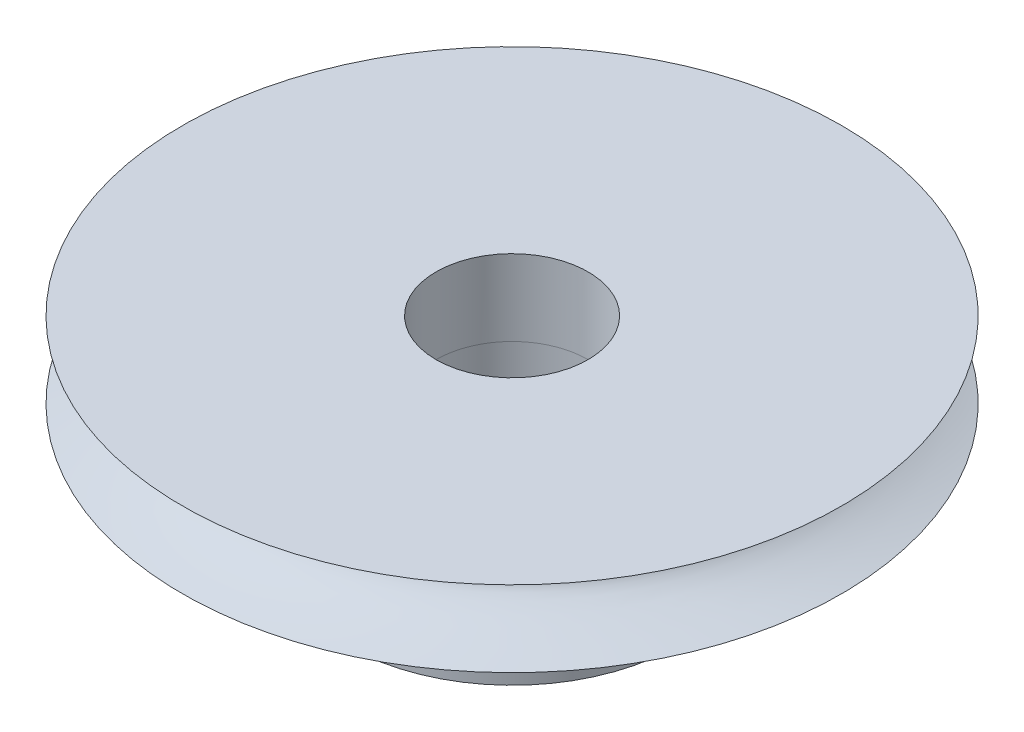
from build123d import *

# Parameters (mm, degrees)
SKETCH117_R           = 3
CUT_EXTRUDE4_DEPTH    = 3
SKETCH122_R           = 6.539767279
BOSS_EXTRUDE1_DEPTH   = 5
SKETCH123_R           = 3.0360463
CUT_EXTRUDE5_DEPTH    = 5
M2X0_4_TAPPED_HOLE1_D = 1.6


with BuildPart() as part:
    # Sketch9 → Revolve1 (revolve)
    with BuildSketch(Plane.XY):
        with BuildLine():
            Line((-4.703089141, -2.935363462), (8.296910859, -2.935363462))
            Line((8.296910859, -2.935363462), (8.296910859, 0.064636538))
            Line((8.296910859, 0.064636538), (-4.703089141, 0.064636538))
            add(Edge.make_bspline(
                [(-4.703089141, 0.064636538), (0.132127885, -1.294166307), (-4.703089141, -2.935363462)],
                knots=[0, 0, 0, 1, 1, 1], degree=2))
        make_face()
    revolve(axis=Axis((8.296910859, -2.935363462, 0), (0, 1, 0)))

    # Sketch117 → Cut-Extrude4 (cut)
    with BuildSketch(Plane(origin=(0, 0.064636538, 0), x_dir=(1, 0, 0), z_dir=(0, 1, 0))):
        with Locations((8.29691086, 0)):
            Circle(SKETCH117_R)
    extrude(amount=-CUT_EXTRUDE4_DEPTH, mode=Mode.SUBTRACT)

    # Sketch122 → Boss-Extrude1 (add)
    with BuildSketch(Plane(origin=(0, -2.935363462, 0), x_dir=(-1, 0, 0), z_dir=(0, -1, 0))):
        with Locations((-8.29691086, 0)):
            Circle(SKETCH122_R)
    extrude(amount=BOSS_EXTRUDE1_DEPTH)

    # Sketch123 → Cut-Extrude5 (cut)
    with BuildSketch(Plane(origin=(0, -2.935363462, 0), x_dir=(1, 0, 0), z_dir=(0, 1, 0))):
        with Locations((8.33295716, 0)):
            Circle(SKETCH123_R)
    extrude(amount=-CUT_EXTRUDE5_DEPTH, mode=Mode.SUBTRACT)

    # M2x0.4 Tapped Hole1 (through all)
    with Locations(Plane(origin=(1.815385484, -5.431649491, -0.870852953), x_dir=(0.133162682309, 0, -0.991094193324), z_dir=(-0.991094193324, 0, -0.133162682309))):
        with Locations((0, 0)):
            Hole(M2X0_4_TAPPED_HOLE1_D / 2)


solid = part.part
